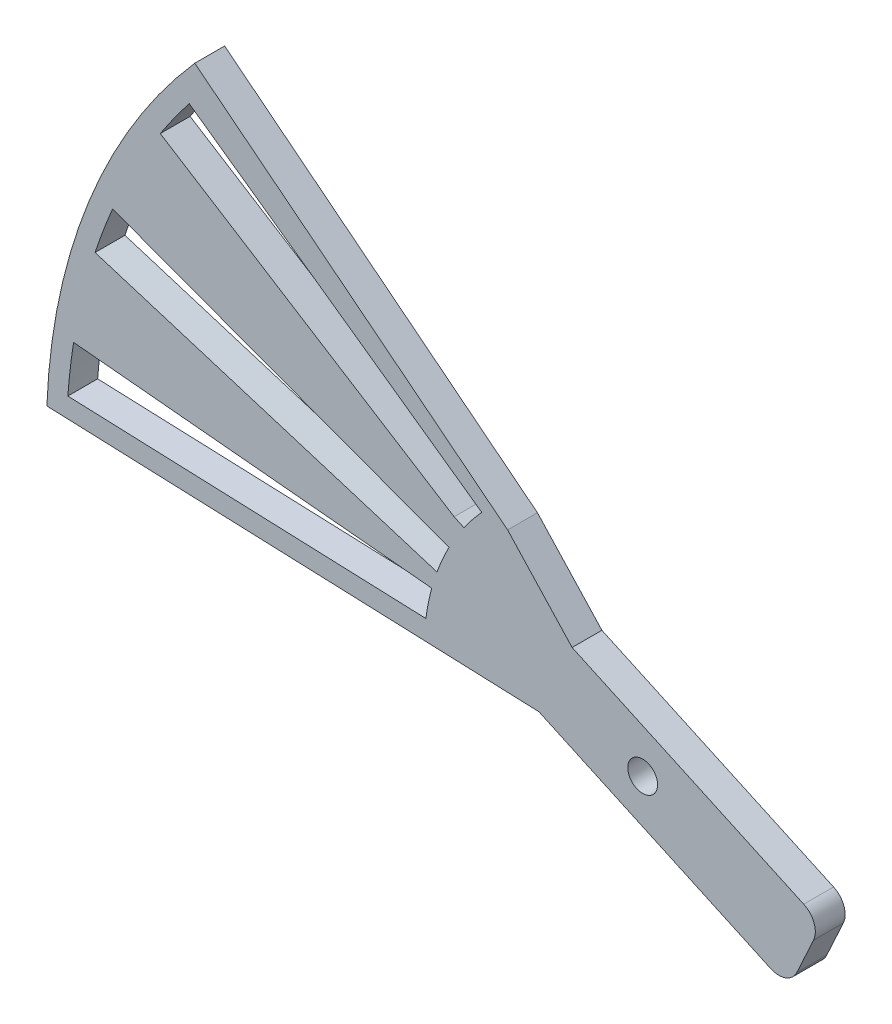
from build123d import *

# Parameters (mm, degrees)
BOSS_EXTRUDE2_DEPTH = 3
CUT_EXTRUDE1_DEPTH  = 72.917502797
SKETCH1_8_R         = 1.5
BOSS_EXTRUDE5_DEPTH = 3
FILLET1_R           = 2


with BuildPart() as part:
    # Sketch1 → Boss-Extrude2 (new body)
    with BuildSketch(Plane.XY):
        with BuildLine():
            Line((-19.985447982, 0.762803358), (-59.956343946, 2.288410074))
            ThreePointArc((-59.956343946, 2.288410074), (-55.730717245, 22.228071336), (-45.073672701, 39.602576043))
            Line((-45.073672701, 39.602576043), (-13.592462366, 14.67122922))
            ThreePointArc((-13.592462366, 14.67122922), (-18.172234131, 8.352838241), (-19.985447982, 0.762803358))
        make_face()
    extrude(amount=BOSS_EXTRUDE2_DEPTH)

    # Sketch1<5> → Cut-Extrude1 (cut, through all)
    with BuildSketch(Plane.XY):
        with BuildLine():
            ThreePointArc((-21.816681027, 2.834154011), (-21.572673921, 4.315059664), (-21.2282638, 5.775882272))
            Line((-21.2282638, 5.775882272), (-57.269563461, 9.175897829))
            ThreePointArc((-57.269563461, 9.175897829), (-57.611850796, 6.698854216), (-57.847050894, 4.209358967))
            Line((-57.847050894, 4.209358967), (-21.816681027, 2.834154011))
        make_face()
        with BuildLine():
            Line((-18.974652115, 13.123988942), (-17.985708937, 12.669422798))
            ThreePointArc((-17.985708937, 12.669422798), (-17.201666988, 13.715052053), (-16.356919422, 14.712280144))
            Line((-16.356919422, 14.712280144), (-16.19149009, 14.894148135))
            Line((-16.19149009, 14.894148135), (-45.633154018, 35.799654388))
            ThreePointArc((-45.633154018, 35.799654388), (-47.133831778, 33.799436415), (-48.546898537, 31.736393028))
            Line((-48.546898537, 31.736393028), (-18.974652115, 13.123988942))
        make_face()
        with BuildLine():
            Line((-55.106686022, 18.090139737), (-20.700540486, 7.449001516))
            ThreePointArc((-20.700540486, 7.449001516), (-20.144482043, 8.843067523), (-19.494667642, 10.19597634))
            Line((-19.494667642, 10.19597634), (-53.343874365, 22.769081398))
            ThreePointArc((-53.343874365, 22.769081398), (-54.275723264, 20.448615214), (-55.106686022, 18.090139737))
        make_face()
    extrude(amount=CUT_EXTRUDE1_DEPTH, mode=Mode.SUBTRACT)

    # Sketch1<8> → Boss-Extrude5 (add)
    with BuildSketch(Plane.XY):
        with BuildLine():
            ThreePointArc((-19.475648091, 4.549629811), (-19.821189154, 2.668419106), (-19.985447982, 0.762803358))
            Line((-19.985447982, 0.762803358), (-10.444898468, 0.398660247))
            Line((-10.444898468, 0.398660247), (14.68444307, -11.152001243))
            Line((14.68444307, -11.152001243), (18.025578366, -3.883107591))
            Line((18.025578366, -3.883107591), (-7.103763171, 7.667553899))
            Line((-7.103763171, 7.667553899), (-13.592462366, 14.67122922))
            ThreePointArc((-13.592462366, 14.67122922), (-14.931769674, 13.305722619), (-16.134512795, 11.818523464))
            ThreePointArc((-16.134512795, 11.818523464), (-18.172234131, 8.352838241), (-19.475648091, 4.549629811))
        make_face()
        Circle(SKETCH1_8_R, mode=Mode.SUBTRACT)
    extrude(amount=BOSS_EXTRUDE5_DEPTH)

    # Fillet1
    fillet1_edges = [part.edges().sort_by_distance(p)[0] for p in [
        (18.025578366, -3.883107591, 1.5),
        (14.68444307, -11.152001243, 1.5),
    ]]
    fillet(fillet1_edges, radius=FILLET1_R)


solid = part.part
